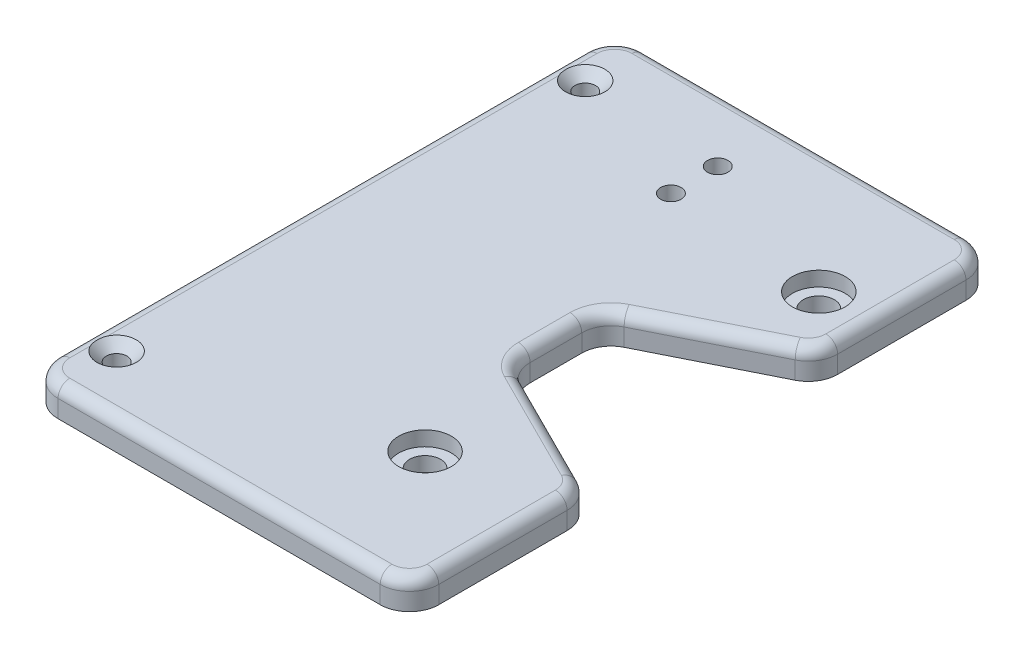
from build123d import *

# Parameters (mm, degrees)
SKETCH2_W           = 65
SKETCH2_H           = 100
SKETCH2_R           = 1.75
SKETCH2_R_2         = 2.65
BOSS_EXTRUDE1_DEPTH = 5
SKETCH3_R           = 4.5
CUT_EXTRUDE1_DEPTH  = 2.5
CUT_EXTRUDE2_DEPTH  = 60.843546018
FILLET1_R           = 5
CHAMFER1_SIZE       = 1.6
FILLET3_R           = 5
FILLET2_R           = 2
SKETCH5_R           = 1.75
CUT_EXTRUDE3_DEPTH  = 60.843546072


with BuildPart() as part:
    # Sketch2 → Boss-Extrude1 (new body)
    with BuildSketch(Plane(origin=(0, 0, 0), x_dir=(1, 0, 0), z_dir=(0, 1, 0))):
        Rectangle(SKETCH2_W, SKETCH2_H)
        with Locations(Location((-27.5, 40, 0), (0, 0, 270))):
            Circle(SKETCH2_R, mode=Mode.SUBTRACT)
        with Locations(Location((-27.5, -40, 0), (0, 0, 270))):
            Circle(SKETCH2_R, mode=Mode.SUBTRACT)
        with Locations(Location((23.6525, 28.725, 0), (0, 0, 270))):
            Circle(SKETCH2_R_2, mode=Mode.SUBTRACT)
        with Locations(Location((13.65, -28.4925, 0), (0, 0, 270))):
            Circle(SKETCH2_R_2, mode=Mode.SUBTRACT)
    extrude(amount=BOSS_EXTRUDE1_DEPTH)

    # Sketch3 → Cut-Extrude1 (cut)
    with BuildSketch(Plane(origin=(0, 5, 0), x_dir=(1, 0, 0), z_dir=(0, 1, 0))):
        with Locations(Location((23.6525, 28.725, 0), (0, 0, 270))):
            Circle(SKETCH3_R)
        with Locations(Location((13.65, -28.4925, 0), (0, 0, 270))):
            Circle(SKETCH3_R)
    extrude(amount=-CUT_EXTRUDE1_DEPTH, mode=Mode.SUBTRACT)

    # Sketch4 → Cut-Extrude2 (cut, through all)
    with BuildSketch(Plane(origin=(0, 5, 0), x_dir=(1, 0, 0), z_dir=(0, 1, 0))):
        Polygon((7.5, 7.5), (7.5, -7.5), (32.5, -20), (32.5, 20), align=None)
    extrude(amount=-CUT_EXTRUDE2_DEPTH, mode=Mode.SUBTRACT)

    # Fillet1
    fillet1_edges = [part.edges().sort_by_distance(p)[0] for p in [
        (32.5, 2.5, 50),
        (-32.5, 2.5, 50),
        (-32.5, 2.5, -50),
        (32.5, 2.5, -50),
    ]]
    fillet(fillet1_edges, radius=FILLET1_R)

    # Chamfer1
    chamfer1_edges = [part.edges().sort_by_distance(p)[0] for p in [
        (-27.5, 5, -41.75),
        (-27.5, 5, 38.25),
    ]]
    chamfer(chamfer1_edges, length=CHAMFER1_SIZE)

    # Fillet3
    fillet3_edges = [part.edges().sort_by_distance(p)[0] for p in [
        (7.5, 2.5, -7.5),
        (32.5, 2.5, -20),
        (32.5, 2.5, 20),
        (7.5, 2.5, 7.5),
    ]]
    fillet(fillet3_edges, radius=FILLET3_R)

    # Fillet2
    # the kernel refuses this fillet: 2 mm, written as the material it takes off along each edge
    with BuildSketch(Plane(origin=(12.5, 5, 4.409830056), x_dir=(-0.447213595499958, 0, 0.894427190999916), z_dir=(0.894427190999916, 0, 0.447213595499958))) as fillet2_piece_1:
        with BuildLine():
            CenterArc((5 + FILLET2_R, FILLET2_R), FILLET2_R, 180, 90)
            Line((5, FILLET2_R), (5, 0))
            Line((5, 0), (5 + FILLET2_R, 0))
        make_face()
    revolve(axis=Axis((12.5, 5, 4.409830056), (0, -1, 0)), revolution_arc=63.434948823, mode=Mode.SUBTRACT)
    with BuildSketch(Plane(origin=(12.5, 5, -4.409830056), x_dir=(-0.447213595499958, 0, -0.894427190999916), z_dir=(0.894427190999916, 0, -0.447213595499958))) as fillet2_piece_2:
        with BuildLine():
            CenterArc((5 + FILLET2_R, -FILLET2_R), FILLET2_R, 90, 90)
            Line((5, -FILLET2_R), (5, 0))
            Line((5, 0), (5 + FILLET2_R, 0))
        make_face()
    revolve(axis=Axis((12.5, 5, -4.409830056), (0, 1, 0)), revolution_arc=63.434948823, mode=Mode.SUBTRACT)
    with BuildSketch(Plane(origin=(32.5, 5, 23.090169944), x_dir=(-1, 0, 0), z_dir=(0, 0, 1)), Plane(origin=(32.5, 5, -45), x_dir=(-1, 0, 0), z_dir=(0, 0, 1))) as fillet2_piece_3:
        with BuildLine():
            CenterArc((FILLET2_R, FILLET2_R), FILLET2_R, 180, 90)
            Line((0, FILLET2_R), (0, 0))
            Line((0, 0), (FILLET2_R, 0))
        make_face()
    extrude(amount=21.909830056, mode=Mode.SUBTRACT)
    with BuildSketch(Plane(origin=(27.5, 5, 50), x_dir=(0, 0, -1), z_dir=(-1, 0, 0)), Plane(origin=(-27.5, 5, -50), x_dir=(0, 0, 1), z_dir=(1, 0, 0))) as fillet2_piece_4:
        with BuildLine():
            CenterArc((FILLET2_R, FILLET2_R), FILLET2_R, 180, 90)
            Line((0, FILLET2_R), (0, 0))
            Line((0, 0), (FILLET2_R, 0))
        make_face()
    extrude(amount=55, mode=Mode.SUBTRACT)
    with BuildSketch(Plane(origin=(-32.5, 5, 45), x_dir=(1, 0, 0), z_dir=(0, 0, -1))) as fillet2_piece_5:
        with BuildLine():
            CenterArc((FILLET2_R, FILLET2_R), FILLET2_R, 180, 90)
            Line((0, FILLET2_R), (0, 0))
            Line((0, 0), (FILLET2_R, 0))
        make_face()
    extrude(amount=90, mode=Mode.SUBTRACT)
    with BuildSketch(Plane(origin=(-27.5, 5, 45), x_dir=(-1, 0, 0), z_dir=(0, 0, -1))) as fillet2_piece_6:
        with BuildLine():
            CenterArc((5 - FILLET2_R, -FILLET2_R), FILLET2_R, 0, 90)
            Line((5, -FILLET2_R), (5, 0))
            Line((5, 0), (5 - FILLET2_R, 0))
        make_face()
    revolve(axis=Axis((-27.5, 5, 45), (0, 1, 0)), revolution_arc=90, mode=Mode.SUBTRACT)
    with BuildSketch(Plane(origin=(27.5, 5, -45), x_dir=(0, 0, -1), z_dir=(-1, 0, 0))) as fillet2_piece_7:
        with BuildLine():
            CenterArc((5 - FILLET2_R, FILLET2_R), FILLET2_R, 270, 90)
            Line((5, FILLET2_R), (5, 0))
            Line((5, 0), (5 - FILLET2_R, 0))
        make_face()
    revolve(axis=Axis((27.5, 5, -45), (0, -1, 0)), revolution_arc=90, mode=Mode.SUBTRACT)
    with BuildSketch(Plane(origin=(-27.5, 5, -45), x_dir=(0, 0, -1), z_dir=(1, 0, 0))) as fillet2_piece_8:
        with BuildLine():
            CenterArc((5 - FILLET2_R, -FILLET2_R), FILLET2_R, 0, 90)
            Line((5, -FILLET2_R), (5, 0))
            Line((5, 0), (5 - FILLET2_R, 0))
        make_face()
    revolve(axis=Axis((-27.5, 5, -45), (0, 1, 0)), revolution_arc=90, mode=Mode.SUBTRACT)
    with BuildSketch(Plane(origin=(27.5, 5, 45), x_dir=(0, 0, 1), z_dir=(-1, 0, 0))) as fillet2_piece_9:
        with BuildLine():
            CenterArc((5 - FILLET2_R, -FILLET2_R), FILLET2_R, 0, 90)
            Line((5, -FILLET2_R), (5, 0))
            Line((5, 0), (5 - FILLET2_R, 0))
        make_face()
    revolve(axis=Axis((27.5, 5, 45), (0, 1, 0)), revolution_arc=90, mode=Mode.SUBTRACT)
    with BuildSketch(Plane(origin=(29.736067977, 5, -18.618033989), x_dir=(-0.4472135954999579, 0, -0.8944271909999159), z_dir=(-0.894427190999916, 0, 0.4472135954999579)), Plane(origin=(10.263932023, 5, 8.881966011), x_dir=(-0.4472135954999579, 0, 0.894427190999916), z_dir=(0.894427190999916, 0, 0.4472135954999579))) as fillet2_piece_10:
        with BuildLine():
            CenterArc((FILLET2_R, FILLET2_R), FILLET2_R, 180, 90)
            Line((0, FILLET2_R), (0, 0))
            Line((0, 0), (FILLET2_R, 0))
        make_face()
    extrude(amount=21.770509831, mode=Mode.SUBTRACT)
    with BuildSketch(Plane(origin=(7.5, 5, -4.409830056), x_dir=(-1, 0, 0), z_dir=(0, 0, 1))) as fillet2_piece_11:
        with BuildLine():
            CenterArc((FILLET2_R, FILLET2_R), FILLET2_R, 180, 90)
            Line((0, FILLET2_R), (0, 0))
            Line((0, 0), (FILLET2_R, 0))
        make_face()
    extrude(amount=8.819660113, mode=Mode.SUBTRACT)
    with BuildSketch(Plane(origin=(27.5, 5, 23.090169944), x_dir=(1, 0, 0), z_dir=(0, 0, 1))) as fillet2_piece_12:
        with BuildLine():
            CenterArc((5 - FILLET2_R, -FILLET2_R), FILLET2_R, 0, 90)
            Line((5, -FILLET2_R), (5, 0))
            Line((5, 0), (5 - FILLET2_R, 0))
        make_face()
    revolve(axis=Axis((27.5, 5, 23.090169944), (0, 1, 0)), revolution_arc=63.434948823, mode=Mode.SUBTRACT)
    with BuildSketch(Plane(origin=(27.5, 5, -23.090169944), x_dir=(1, 0, 0), z_dir=(0, 0, -1))) as fillet2_piece_13:
        with BuildLine():
            CenterArc((5 - FILLET2_R, FILLET2_R), FILLET2_R, 270, 90)
            Line((5, FILLET2_R), (5, 0))
            Line((5, 0), (5 - FILLET2_R, 0))
        make_face()
    revolve(axis=Axis((27.5, 5, -23.090169944), (0, -1, 0)), revolution_arc=63.434948823, mode=Mode.SUBTRACT)

    # Sketch5 → Cut-Extrude3 (cut, through all)
    with BuildSketch(Plane(origin=(0, 5, 0), x_dir=(1, 0, 0), z_dir=(0, 1, 0))):
        with Locations(Location((-3.507863002, 38.632025627, 0), (0, 0, 270))):
            Circle(SKETCH5_R)
        with Locations(Location((-3.507863002, 30.632025627, 0), (0, 0, 270))):
            Circle(SKETCH5_R)
    extrude(amount=-CUT_EXTRUDE3_DEPTH, mode=Mode.SUBTRACT)


solid = part.part
